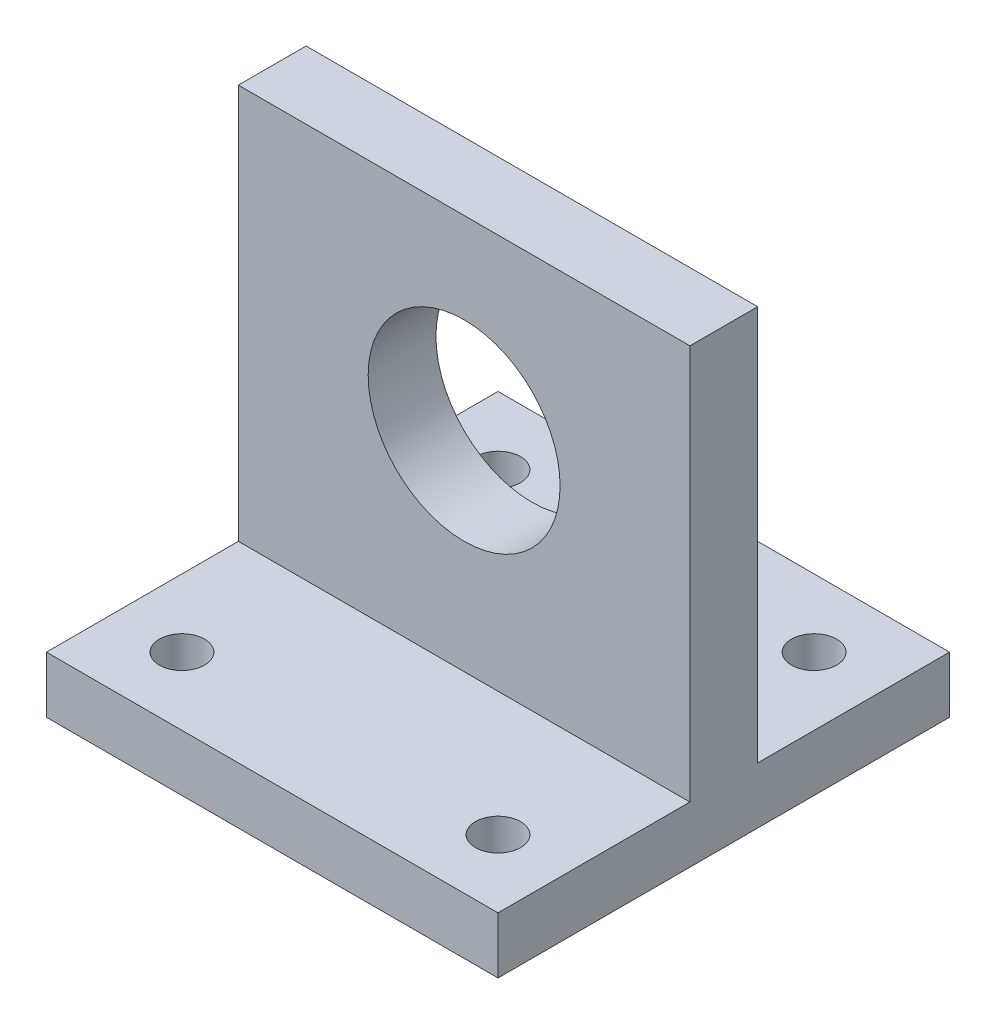
from build123d import *

# Parameters (mm, degrees)
SKETCH1_W           = 40
SKETCH1_H           = 40
BOSS_EXTRUDE1_DEPTH = 5
SKETCH2_W           = 40
SKETCH2_H           = 6
BOSS_EXTRUDE2_DEPTH = 35
SKETCH3_R           = 2
CUT_EXTRUDE1_DEPTH  = 46
SKETCH4_R           = 8.5
CUT_EXTRUDE2_DEPTH  = 51.289163843


with BuildPart() as part:
    # Sketch1 → Boss-Extrude1 (new body)
    with BuildSketch(Plane(origin=(0, 0, 0), x_dir=(1, 0, 0), z_dir=(0, 1, 0))):
        Rectangle(SKETCH1_W, SKETCH1_H)
    extrude(amount=BOSS_EXTRUDE1_DEPTH)

    # Sketch2 → Boss-Extrude2 (add)
    with BuildSketch(Plane(origin=(0, 5, 0), x_dir=(1, 0, 0), z_dir=(0, 1, 0))):
        Rectangle(SKETCH2_W, SKETCH2_H)
    extrude(amount=BOSS_EXTRUDE2_DEPTH)

    # Sketch3 → Cut-Extrude1 (cut, through all)
    with BuildSketch(Plane(origin=(0, 5, 0), x_dir=(1, 0, 0), z_dir=(0, 1, 0))):
        with Locations((-14, 14)):
            Circle(SKETCH3_R)
        with Locations((14, 14)):
            Circle(SKETCH3_R)
    cut_extrude1 = extrude(amount=-CUT_EXTRUDE1_DEPTH, mode=Mode.SUBTRACT)

    # Mirror1: Cut-Extrude1 across plane
    add(cut_extrude1.mirror(Plane.XY), mode=Mode.SUBTRACT)

    # Sketch4 → Cut-Extrude2 (cut, through all)
    with BuildSketch(Plane.XY.offset(3)):
        with Locations((0, 23.5)):
            Circle(SKETCH4_R)
    extrude(amount=-CUT_EXTRUDE2_DEPTH, mode=Mode.SUBTRACT)


solid = part.part
